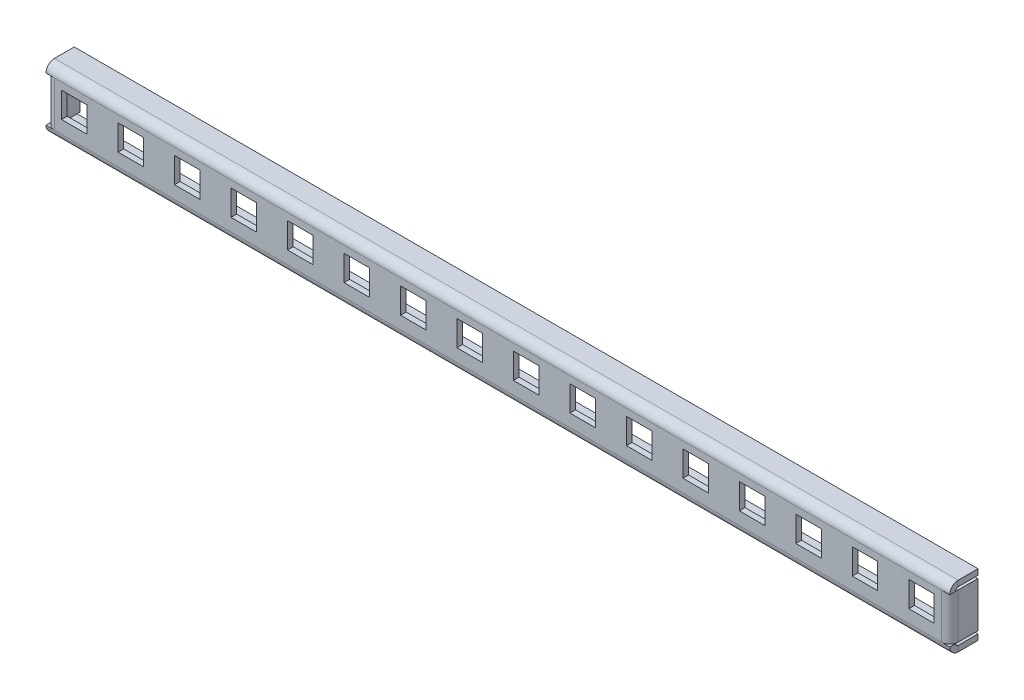
from build123d import *

# Parameters (mm, degrees)
SKETCH_1_W                         = 320
SKETCH_1_H                         = 22
SM_BASE_FLANGE_1_DEPTH             = 2
SM_EDGE_FLANGE_1_STRIP_W           = 10
SM_EDGE_FLANGE_1_STRIP_H           = 2
SM_EDGE_FLANGE_1_STRIP_CUT_DEPTH   = 320
SM_EDGE_FLANGE_1_STRIP_2_W         = 10
SM_EDGE_FLANGE_1_STRIP_2_H         = 2
SM_EDGE_FLANGE_1_STRIP_CUT_2_DEPTH = 320
SM_EDGE_FLANGE_1_DEPTH             = 320
SM_EDGE_FLANGE_1_BEND_DEPTH        = 320
SM_EDGE_FLANGE_2_STRIP_W           = 10
SM_EDGE_FLANGE_2_STRIP_H           = 2
SM_EDGE_FLANGE_2_STRIP_CUT_DEPTH   = 16
SM_EDGE_FLANGE_2_STRIP_2_W         = 10
SM_EDGE_FLANGE_2_STRIP_2_H         = 2
SM_EDGE_FLANGE_2_STRIP_CUT_2_DEPTH = 16
SM_EDGE_FLANGE_2_DEPTH             = 16
SM_EDGE_FLANGE_2_BEND_DEPTH        = 16
SKETCH_18_W                        = 9
SKETCH_18_H                        = 9
CUT_EXTRUDE_1_DEPTH                = 10
PATTERN_LINEAR_1_COUNT             = 20
PATTERN_LINEAR_1_PITCH             = 20


# Sheet-metal steps are written as plain solids
with BuildPart() as part:
    # Sketch 1 → 基体-法兰1 (new body)
    with BuildSketch(Plane.XY):
        Rectangle(SKETCH_1_W, SKETCH_1_H)
    extrude(amount=-SM_BASE_FLANGE_1_DEPTH)

    # 边线-法兰1 strip (across the edge) → 边线-法兰1 strip cut (cut)
    with BuildSketch(Plane(origin=(160, -11, -2), x_dir=(0, 1, 0), z_dir=(-1, 0, 0))):
        with Locations((-2, -1)):
            Rectangle(SM_EDGE_FLANGE_1_STRIP_W, SM_EDGE_FLANGE_1_STRIP_H)
    extrude(amount=SM_EDGE_FLANGE_1_STRIP_CUT_DEPTH, mode=Mode.SUBTRACT)

    # 边线-法兰1 strip 2 (across the edge) → 边线-法兰1 strip cut 2 (cut)
    with BuildSketch(Plane(origin=(-160, 11, -2), x_dir=(0, -1, 0), z_dir=(1, 0, 0))):
        with Locations((-2, -1)):
            Rectangle(SM_EDGE_FLANGE_1_STRIP_2_W, SM_EDGE_FLANGE_1_STRIP_2_H)
    extrude(amount=SM_EDGE_FLANGE_1_STRIP_CUT_2_DEPTH, mode=Mode.SUBTRACT)

    # 边线-法兰1 section (across the edge) → 边线-法兰1 (add)
    with BuildSketch(Plane(origin=(160, -11, -2), x_dir=(0, 1, 0), z_dir=(-1, 0, 0))):
        with BuildLine():
            Line((0, 1), (0, 8))
            Line((0, 8), (2, 8))
            Line((2, 8), (2, 1))
            ThreePointArc((2, 1), (2.292893219, 0.292893219), (3, 0))
            Line((3, 0), (3, -2))
            ThreePointArc((3, -2), (0.878679656, -1.121320344), (0, 1))
        make_face()
    extrude(amount=SM_EDGE_FLANGE_1_DEPTH)

    # 边线-法兰1 section 2 (across the edge) → 边线-法兰1 bend (add)
    with BuildSketch(Plane(origin=(-160, 11, -2), x_dir=(0, -1, 0), z_dir=(1, 0, 0))):
        with BuildLine():
            Line((0, 1), (0, 8))
            Line((0, 8), (2, 8))
            Line((2, 8), (2, 1))
            ThreePointArc((2, 1), (2.292893219, 0.292893219), (3, 0))
            Line((3, 0), (3, -2))
            ThreePointArc((3, -2), (0.878679656, -1.121320344), (0, 1))
        make_face()
    extrude(amount=SM_EDGE_FLANGE_1_BEND_DEPTH)

    # 边线-法兰2 strip (across the edge) → 边线-法兰2 strip cut (cut)
    with BuildSketch(Plane(origin=(-160, -8, -2), x_dir=(1, 0, 0), z_dir=(0, 1, 0))):
        with Locations((-2, -1)):
            Rectangle(SM_EDGE_FLANGE_2_STRIP_W, SM_EDGE_FLANGE_2_STRIP_H)
    extrude(amount=SM_EDGE_FLANGE_2_STRIP_CUT_DEPTH, mode=Mode.SUBTRACT)

    # 边线-法兰2 strip 2 (across the edge) → 边线-法兰2 strip cut 2 (cut)
    with BuildSketch(Plane(origin=(160, 8, -2), x_dir=(-1, 0, 0), z_dir=(0, -1, 0))):
        with Locations((-2, -1)):
            Rectangle(SM_EDGE_FLANGE_2_STRIP_2_W, SM_EDGE_FLANGE_2_STRIP_2_H)
    extrude(amount=SM_EDGE_FLANGE_2_STRIP_CUT_2_DEPTH, mode=Mode.SUBTRACT)

    # 边线-法兰2 section (across the edge) → 边线-法兰2 (add)
    with BuildSketch(Plane(origin=(-160, -8, -2), x_dir=(1, 0, 0), z_dir=(0, 1, 0))):
        with BuildLine():
            Line((0, 1), (0, 8))
            Line((0, 8), (2, 8))
            Line((2, 8), (2, 1))
            ThreePointArc((2, 1), (2.292893219, 0.292893219), (3, 0))
            Line((3, 0), (3, -2))
            ThreePointArc((3, -2), (0.878679656, -1.121320344), (0, 1))
        make_face()
    extrude(amount=SM_EDGE_FLANGE_2_DEPTH)

    # 边线-法兰2 section 2 (across the edge) → 边线-法兰2 bend (add)
    with BuildSketch(Plane(origin=(160, 8, -2), x_dir=(-1, 0, 0), z_dir=(0, -1, 0))):
        with BuildLine():
            Line((0, 1), (0, 8))
            Line((0, 8), (2, 8))
            Line((2, 8), (2, 1))
            ThreePointArc((2, 1), (2.292893219, 0.292893219), (3, 0))
            Line((3, 0), (3, -2))
            ThreePointArc((3, -2), (0.878679656, -1.121320344), (0, 1))
        make_face()
    extrude(amount=SM_EDGE_FLANGE_2_BEND_DEPTH)

    # 草图18 → 切除-拉伸1 (cut)
    with BuildSketch(Plane.XY):
        with Locations((-150, 1)):
            Rectangle(SKETCH_18_W, SKETCH_18_H)
    cut_extrude_1 = extrude(amount=-CUT_EXTRUDE_1_DEPTH, mode=Mode.SUBTRACT)

    # 阵列(线性)1: 切除-拉伸1 ×20
    with Locations(*[(i * PATTERN_LINEAR_1_PITCH, 0, 0) for i in range(1, PATTERN_LINEAR_1_COUNT)]):
        add(cut_extrude_1, mode=Mode.SUBTRACT)


solid = part.part
